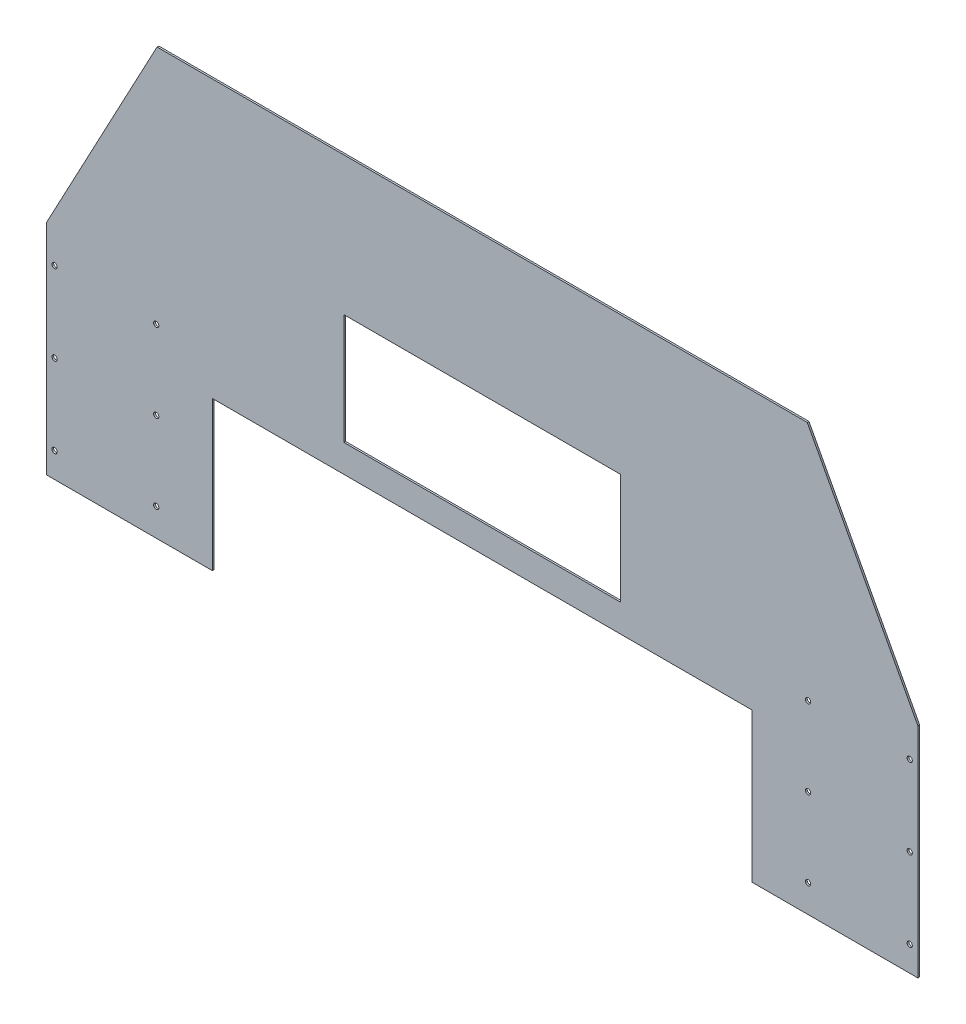
from build123d import *

# Parameters (mm, degrees)
BASE_FLANGE1_DEPTH = 1.6002
SKETCH2_R          = 2.413
CUT_EXTRUDE1_DEPTH = 781.091023438
SKETCH3_W          = 254
SKETCH3_H          = 101.6
CUT_EXTRUDE2_DEPTH = 781.091023438


# Sheet-metal steps are written as plain solids
with BuildPart() as part:
    # Sketch1 → Base-Flange1 (new body)
    with BuildSketch(Plane.XY):
        Polygon((-76.2, -100.203), (76.2, -100.203), (76.2, 36.703), (571.5, 36.703), (571.5, -100.203), (723.9, -100.203), (723.9, 100.203), (622.3, 290.703), (25.4, 290.703), (-76.2, 100.203), align=None)
    extrude(amount=-BASE_FLANGE1_DEPTH)

    # Sketch2 → Cut-Extrude1 (cut, through all)
    with BuildSketch(Plane.XY):
        with Locations((24.637999896, 69.8754)):
            Circle(SKETCH2_R)
        with Locations((-68.6816, 69.8754)):
            Circle(SKETCH2_R)
        with Locations((24.637999896, -2.4638)):
            Circle(SKETCH2_R)
        with Locations((-68.6816, -3.6322)):
            Circle(SKETCH2_R)
        with Locations((-68.6816, -77.1398)):
            Circle(SKETCH2_R)
        with Locations((24.637999896, -74.803)):
            Circle(SKETCH2_R)
    cut_extrude1 = extrude(amount=-CUT_EXTRUDE1_DEPTH, mode=Mode.SUBTRACT)

    # Mirror1: Cut-Extrude1 across plane
    add(cut_extrude1.mirror(Plane.ZY.offset(-323.85)), mode=Mode.SUBTRACT)

    # Sketch3 → Cut-Extrude2 (cut, through all)
    with BuildSketch(Plane(origin=(0, 0, -1.6002), x_dir=(-1, 0, 0), z_dir=(0, 0, -1))):
        with Locations((-323.85, 112.903)):
            Rectangle(SKETCH3_W, SKETCH3_H)
    extrude(amount=-CUT_EXTRUDE2_DEPTH, mode=Mode.SUBTRACT)


solid = part.part
